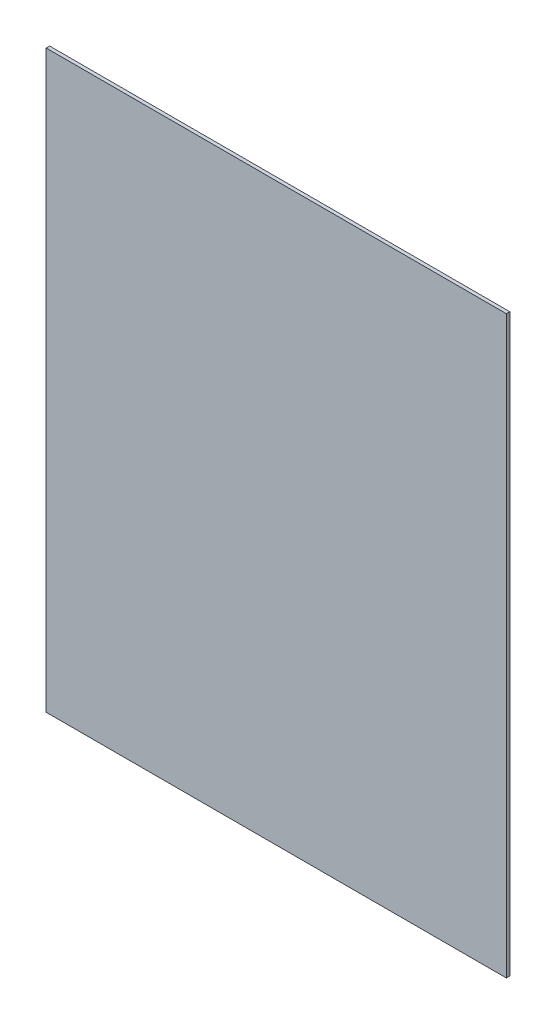
from build123d import *

# Parameters (mm, degrees)
ESBO_O1_W                = 400
ESBO_O1_H                = 500
RESSALTO_EXTRUS_O1_DEPTH = 3


with BuildPart() as part:
    # Esboço1 → Ressalto-extrusão1 (new body)
    with BuildSketch(Plane.XY):
        Rectangle(ESBO_O1_W, ESBO_O1_H)
    extrude(amount=RESSALTO_EXTRUS_O1_DEPTH)


solid = part.part
